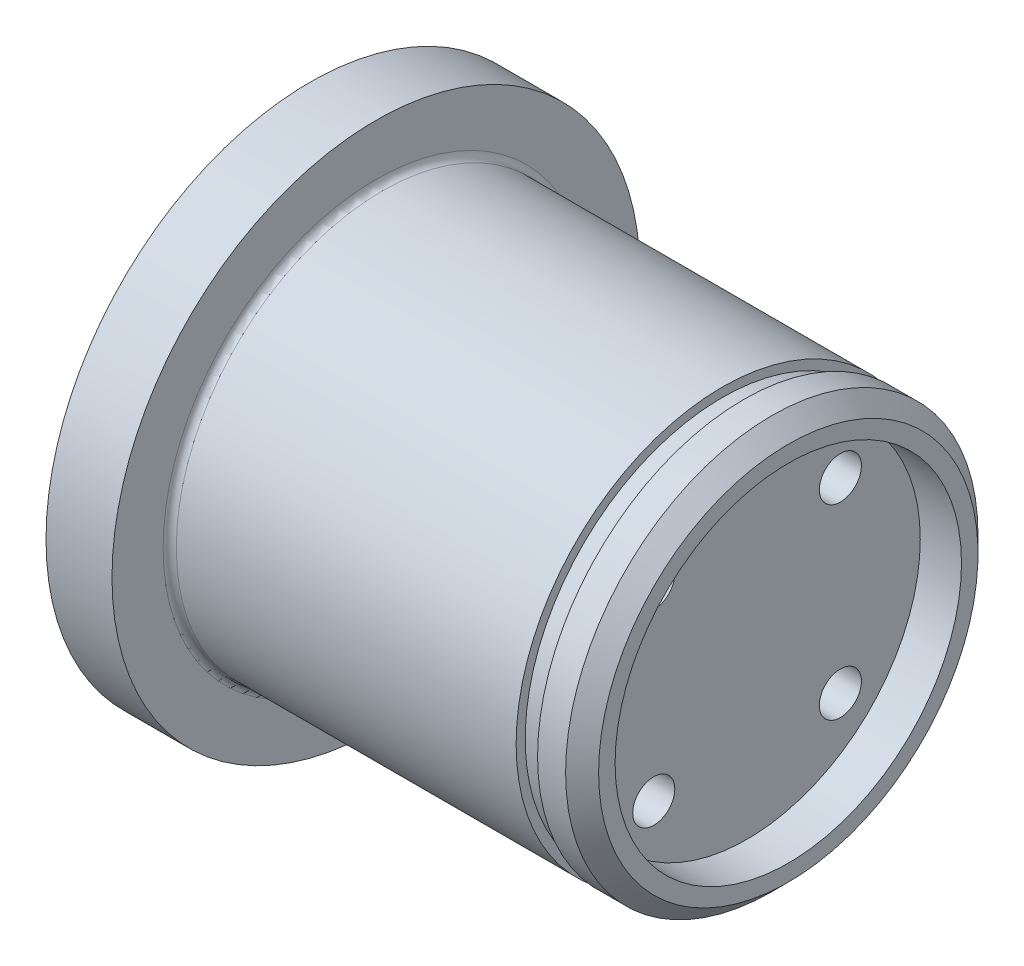
from build123d import *

# Parameters (mm, degrees)
SKETCH_2_W               = 1.3
SKETCH_2_H               = 0.55
CHAMFER_1_SIZE           = 1
FILLET_1_R               = 0.4
HOLE_WIZARD_M2_51_D      = 2.55
PATTERN_CIRCULAR_1_COUNT = 4
SKETCH_5_W               = 2.5
SKETCH_5_H               = 10.5


with BuildPart() as part:
    # Эскиз1 → Повернуть1 (revolve)
    with BuildSketch(Plane.XY):
        Polygon((0, 0), (0, 12.5), (-25, 12.5), (-25, 16), (-29, 16), (-29, 0), align=None)
    revolve(axis=Axis((0, 0, 0), (1, 0, 0)))

    # Эскиз2 → Вырез-Повернуть1 (revolve, cut)
    with BuildSketch(Plane.XY):
        with Locations((-3.35, 12.225)):
            Rectangle(SKETCH_2_W, SKETCH_2_H)
    revolve(axis=Axis((0, 0, 0), (-1, 0, 0)), mode=Mode.SUBTRACT)

    # Фаска1
    chamfer_1_edges = [part.edges().sort_by_distance(p)[0] for p in [
        (0, -12.5, 0),
    ]]
    chamfer(chamfer_1_edges, length=CHAMFER_1_SIZE)

    # Скругление1
    fillet_1_edges = [part.edges().sort_by_distance(p)[0] for p in [
        (-25, -12.5, 0),
    ]]
    fillet(fillet_1_edges, radius=FILLET_1_R)

    # Сверло под метчик  спиральное M2.51 (through all)
    with Locations(Plane(origin=(0, 0, 0), x_dir=(0, 0, -1), z_dir=(1, 0, 0))):
        with Locations((5.656854249, 5.656854249)):
            hole_wizard_m2_51 = Hole(HOLE_WIZARD_M2_51_D / 2)

    # Круговой массив1: Сверло под метчик  спиральное M2.51 ×4 about axis
    pattern_circular_1_axis = Axis((0, 0, 0), (-1, 0, 0))
    for i in range(1, PATTERN_CIRCULAR_1_COUNT):
        add(hole_wizard_m2_51.rotate(pattern_circular_1_axis, i * 360 / PATTERN_CIRCULAR_1_COUNT), mode=Mode.SUBTRACT)

    # Эскиз5 → Вырез-Повернуть2 (revolve, cut)
    with BuildSketch(Plane.XY):
        with Locations((-1.25, 5.25)):
            Rectangle(SKETCH_5_W, SKETCH_5_H)
    revolve(axis=Axis((0, 0, 0), (-1, 0, 0)), mode=Mode.SUBTRACT)


solid = part.part
